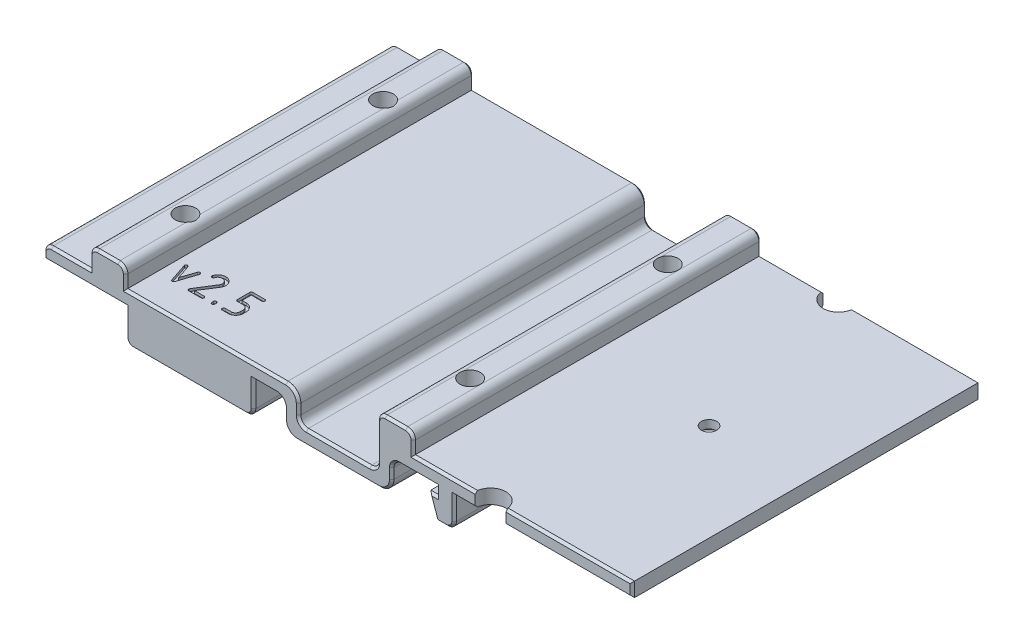
from build123d import *

# Parameters (mm, degrees)
MAINBODY_DEPTH            = 34
FILLET_CORNERS_INSIDE_R   = 1.5
FILLET_CORNERS_OUTSIDE_R  = 2.5
SPRING_SLOT_DEPTH         = 1.05
SPRING_ENTRY_REACH        = 70.899
FILLET2_R                 = 8
CUT_VERSION_DEPTH         = 0.5
SKETCH7_R                 = 1.5
PANEL_HOLE_DEPTH          = 10
SKETCH10_R                = 3
COUNTERBORE_DEPTH         = 1.2
SKETCH11_W                = 7
SKETCH11_H                = 4
BOSS_EXTRUDE2_DEPTH       = 34
HOLES_BATMOUNT_DEPTH      = 69.606705261
HOLES_BATMOUNT_DEPTH_BACK = 69.606705261
SKETCH9_R                 = 2
FILLET3_R                 = 1.5
CHAMF_FACE_SIZE           = 0.45
SKETCH12_R                = 3
CUT_EXTRUDE1_DEPTH        = 69.606705222


with BuildPart() as part:
    # Sketch1 → mainBody (new, symmetric)
    with BuildSketch(Plane.XY):
        Polygon((-18.2, 0), (-18.2, -6.5), (-43.2, -6.5), (-43.2, 0), (-59.2, 0), (-59.2, 2.8), (-9.4, 2.8), (-9.4, -3.2), (6, -3.2), (6, 2.8), (21.072520582, 2.8), (55.8, 2.8), (55.8, 0), (21, 0), (21, -6), (17.5, -6), (16, -1.7), (17.5, -1.7), (17.5, 0), (8.8, 0), (8.8, -6), (-12.2, -6), (-12.2, 0), align=None)
    extrude(amount=MAINBODY_DEPTH, both=True)

    # fillet_corners_inside
    fillet_corners_inside_edges = [part.edges().sort_by_distance(p)[0] for p in [
        (-18.2, -6.5, 0),
        (-43.2, -6.5, 0),
        (-59.2, 2.8, 0),
        (-9.4, -3.2, 0),
        (6, -3.2, 0),
        (21, -6, 0),
        (8.8, 0, 0),
        (-12.2, 0, 0),
    ]]
    fillet(fillet_corners_inside_edges, radius=FILLET_CORNERS_INSIDE_R)

    # fillet_corners_outside
    fillet_corners_outside_edges = [part.edges().sort_by_distance(p)[0] for p in [
        (-9.4, 2.8, 0),
        (8.8, -6, 0),
        (-12.2, -6, 0),
    ]]
    fillet(fillet_corners_outside_edges, radius=FILLET_CORNERS_OUTSIDE_R)

    # Sketch2 → spring_slot (cut, symmetric)
    with BuildSketch(Plane(origin=(0, -2.3, 0), x_dir=(1, 0, 0), z_dir=(0, 1, 0))):
        Polygon((-44, 6.5), (-27.5, 7.5), (-20.5, 11), (-20.5, 16.5), (-18.2, 16.5), (-18.2, -16.5), (-20.5, -16.5), (-20.5, -11), (-27.5, -7.5), (-44, -6.5), align=None)
    extrude(amount=SPRING_SLOT_DEPTH, both=True, mode=Mode.SUBTRACT)

    # spring_entry: up to this face of the body (flat: up to its plane)
    spring_entry_end = Plane(part.part.faces().sort_by_distance((-28.889556928, -1.25, 0))[0])
    # Sketch4 → spring_entry (cut, up to the picked face)
    with BuildSketch(Plane.XZ.offset(6.5), mode=Mode.PRIVATE) as spring_entry_sk1:
        Polygon((-43.2, 4.544815121), (-26.971093639, 5.528385203), (-17, 10.513932023), (-17, -10.513932023), (-26.971093639, -5.528385203), (-43.2, -4.544815121), align=None)
    spring_entry_tool1 = split(extrude(spring_entry_sk1.sketch, amount=-SPRING_ENTRY_REACH, mode=Mode.PRIVATE), bisect_by=spring_entry_end, keep=Keep.BOTH, mode=Mode.PRIVATE)
    add(spring_entry_tool1.solids().sort_by(Axis((-28.217872, -6.5, 0), (0, 1, 0)))[0], mode=Mode.SUBTRACT)

    # Fillet2
    fillet2_edges = [part.edges().sort_by_distance(p)[0] for p in [
        (-26.971093639, -4.925, -5.528385203),
        (-26.971093639, -4.925, 5.528385203),
    ]]
    fillet(fillet2_edges, radius=FILLET2_R)

    # Sketch5 → cut_version (cut)
    with BuildSketch(Plane(origin=(0, 2.8, 0), x_dir=(1, 0, 0), z_dir=(0, 1, 0))):
        with BuildLine():
            add(Edge.make_bspline(
                [(-41.601512481, -24.084865663), (-41.599266039, -24.104295768), (-41.594915441, -24.141925322), (-41.582725099, -24.177780618), (-41.576829268, -24.195121951)],
                knots=[0, 0, 0, 0, 1.032704525, 2, 2, 2, 2], degree=3))
            Line((-41.576829268, -24.195121951), (-40.379249238, -27.77648509))
            add(Edge.make_bspline(
                [(-40.379249238, -27.77648509), (-40.366158729, -27.80789855), (-40.341241866, -27.867691862), (-40.273281502, -27.936414851), (-40.189557542, -27.983520924), (-40.125842153, -27.991953119), (-40.092682927, -27.996341463)],
                knots=[0, 0, 0, 0, 1.054683453, 2.007515722, 2.96305683, 4, 4, 4, 4], degree=3))
            add(Edge.make_bspline(
                [(-40.092682927, -27.996341463), (-40.057919516, -27.992026061), (-39.991876221, -27.983827687), (-39.905120587, -27.937212007), (-39.836949217, -27.867675055), (-39.811914442, -27.808089528), (-39.798780488, -27.776829268)],
                knots=[0, 0, 0, 0, 1.06836729, 2.029677035, 2.966312611, 4, 4, 4, 4], degree=3))
            Line((-39.798780488, -27.776829268), (-38.600645484, -24.194184689))
            add(Edge.make_bspline(
                [(-38.600645484, -24.194184689), (-38.596201969, -24.177105546), (-38.586917044, -24.141417907), (-38.585095923, -24.104576142), (-38.584146341, -24.085365854)],
                knots=[0, 0, 0, 0, 0.957146177, 2, 2, 2, 2], degree=3))
            add(Edge.make_bspline(
                [(-38.584146341, -24.085365854), (-38.585769724, -24.065295583), (-38.588911508, -24.026452945), (-38.607211905, -23.971225807), (-38.63362859, -23.920299891), (-38.672145008, -23.876818457), (-38.717421034, -23.84010539), (-38.768529001, -23.811121378), (-38.826812568, -23.79556053), (-38.866994554, -23.792057914), (-38.887804878, -23.790243902)],
                knots=[0, 0, 0, 0, 1.027789528, 1.989114056, 2.957849911, 3.946954469, 4.938684973, 5.935646619, 6.930867606, 8, 8, 8, 8], degree=3))
            add(Edge.make_bspline(
                [(-38.887804878, -23.790243902), (-38.92088275, -23.794763663), (-38.984249761, -23.803422132), (-39.069193742, -23.848700331), (-39.135838962, -23.918897605), (-39.16116445, -23.978585262), (-39.174390244, -24.009756098)],
                knots=[0, 0, 0, 0, 1.03692919, 1.986436811, 2.948451835, 4, 4, 4, 4], degree=3))
            Line((-39.174390244, -24.009756098), (-40.092649581, -26.742158918))
            Line((-40.092649581, -26.742158918), (-41.003024962, -24.00918326))
            add(Edge.make_bspline(
                [(-41.003024962, -24.00918326), (-41.016476638, -23.978195042), (-41.042374756, -23.918534329), (-41.110385958, -23.848247255), (-41.198345611, -23.803073446), (-41.264080541, -23.794676471), (-41.298780488, -23.790243902)],
                knots=[0, 0, 0, 0, 1.028913269, 1.980936724, 2.934183284, 4, 4, 4, 4], degree=3))
            add(Edge.make_bspline(
                [(-41.298780488, -23.790243902), (-41.318779752, -23.792076376), (-41.357755011, -23.795647563), (-41.414754829, -23.811347063), (-41.465650967, -23.840424361), (-41.511991888, -23.876727956), (-41.551567827, -23.920256963), (-41.579587287, -23.970899614), (-41.597599876, -24.02649028), (-41.600790438, -24.065308303), (-41.602439024, -24.085365854)],
                knots=[0, 0, 0, 0, 1.030543514, 2.008358934, 3.007991962, 4.018680577, 5.024181706, 6.005556065, 6.969456486, 8, 8, 8, 8], degree=3))
            Line((-41.602439024, -24.085365854), (-41.601512481, -24.084865663))
        make_face()
        with BuildLine():
            add(Edge.make_bspline(
                [(-34.362600038, -24.274204459), (-34.32745803, -24.213040732), (-34.257008702, -24.090425559), (-34.189208324, -23.889720748), (-34.144568218, -23.686513454), (-34.138389372, -23.549817015), (-34.135365854, -23.482926829)],
                knots=[0, 0, 0, 0, 1.013787966, 2.032344872, 3.037159877, 4, 4, 4, 4], degree=3))
            add(Edge.make_bspline(
                [(-34.135365854, -23.482926829), (-34.138125458, -23.430814596), (-34.143540461, -23.328557953), (-34.166917971, -23.178610107), (-34.203821489, -23.035463838), (-34.252510745, -22.897993996), (-34.31471738, -22.767004681), (-34.391280016, -22.643426603), (-34.479069053, -22.525954071), (-34.578914585, -22.416717745), (-34.688154113, -22.316885671), (-34.805600824, -22.229040614), (-34.928965133, -22.152878569), (-35.059227034, -22.090006889), (-35.196463702, -22.041677291), (-35.339579053, -22.004708858), (-35.489535321, -21.981349031), (-35.5917908, -21.975931582), (-35.643902439, -21.973170732)],
                knots=[0, 0, 0, 0, 1.058443009, 2.076917897, 3.073239101, 4.054247521, 5.031990651, 6.00955979, 6.999406302, 8.003719833, 9.008033365, 9.997879877, 10.975449016, 11.945752479, 12.926760899, 13.923082103, 14.941556991, 16, 16, 16, 16], degree=3))
            add(Edge.make_bspline(
                [(-35.643902439, -21.973170732), (-35.685820719, -21.974980276), (-35.768306494, -21.978541055), (-35.890278482, -21.994729369), (-36.008282165, -22.019963815), (-36.121985552, -22.05557393), (-36.231384342, -22.100219364), (-36.337714402, -22.151923211), (-36.439056069, -22.215034316), (-36.569094393, -22.309054976), (-36.718090163, -22.445681225), (-36.877592302, -22.629807676), (-37.017662934, -22.83478846), (-37.090849739, -22.984752566), (-37.12804878, -23.06097561)],
                knots=[0, 0, 0, 0, 0.775863489, 1.526725378, 2.27305486, 3.005618887, 3.727569145, 4.457348924, 5.189912951, 5.932977202, 7.423702791, 8.916361755, 10.432662988, 12, 12, 12, 12], degree=3))
            add(Edge.make_bspline(
                [(-37.12804878, -23.06097561), (-37.135666866, -23.079430084), (-37.151300549, -23.117301986), (-37.152859329, -23.158265668), (-37.153658537, -23.179268293)],
                knots=[0, 0, 0, 0, 0.974573408, 2, 2, 2, 2], degree=3))
            add(Edge.make_bspline(
                [(-37.153658537, -23.179268293), (-37.152018926, -23.20014003), (-37.148844065, -23.240555047), (-37.130875585, -23.297914792), (-37.104226682, -23.350415293), (-37.065616519, -23.394884812), (-37.021147, -23.433494975), (-36.968646499, -23.460143878), (-36.911286754, -23.478112357), (-36.870871737, -23.481287219), (-36.85, -23.482926829)],
                knots=[0, 0, 0, 0, 1.052730986, 2.038457085, 3.010444171, 4, 4.989555829, 5.961542915, 6.947269014, 8, 8, 8, 8], degree=3))
            add(Edge.make_bspline(
                [(-36.85, -23.482926829), (-36.815295642, -23.478496474), (-36.749552354, -23.47010369), (-36.661650295, -23.424900995), (-36.593366422, -23.35466862), (-36.568044563, -23.294631773), (-36.554878049, -23.263414634)],
                knots=[0, 0, 0, 0, 1.065202536, 2.017899786, 2.969374635, 4, 4, 4, 4], degree=3))
            add(Edge.make_bspline(
                [(-36.554878049, -23.263414634), (-36.541614886, -23.213595688), (-36.515647515, -23.116057342), (-36.446943972, -22.982417094), (-36.356666224, -22.865891169), (-36.245735942, -22.768521591), (-36.120343987, -22.689069407), (-35.982346178, -22.631157468), (-35.833775324, -22.596513374), (-35.731481654, -22.590747785), (-35.679268293, -22.587804878)],
                knots=[0, 0, 0, 0, 1.030680226, 2.017923977, 2.987398872, 3.96827074, 4.96037523, 5.949767355, 6.953507688, 8, 8, 8, 8], degree=3))
            add(Edge.make_bspline(
                [(-35.679268293, -22.587804878), (-35.617877193, -22.594104007), (-35.497653067, -22.606439789), (-35.326979132, -22.662735093), (-35.17262359, -22.748424787), (-35.038050234, -22.862083858), (-34.92518361, -22.996823449), (-34.841753753, -23.15087421), (-34.790722121, -23.321314239), (-34.78153302, -23.440308357), (-34.776829268, -23.501219512)],
                knots=[0, 0, 0, 0, 1.043300576, 2.043128441, 3.020592189, 4.018068269, 5.011134672, 5.981974443, 6.967005516, 8, 8, 8, 8], degree=3))
            add(Edge.make_bspline(
                [(-34.776829268, -23.501219512), (-34.77798699, -23.543229791), (-34.780289034, -23.626764091), (-34.80634037, -23.748637285), (-34.844515031, -23.867125129), (-34.883775576, -23.939948751), (-34.903658537, -23.976829268)],
                knots=[0, 0, 0, 0, 1.010874498, 2.01004839, 2.992216505, 4, 4, 4, 4], degree=3))
            Line((-34.903658537, -23.976829268), (-37.136862853, -27.531459604))
            add(Edge.make_bspline(
                [(-37.136862853, -27.531459604), (-37.15019468, -27.554157264), (-37.177940978, -27.601395804), (-37.18443248, -27.655854514), (-37.187804878, -27.684146341)],
                knots=[0, 0, 0, 0, 0.960980606, 2, 2, 2, 2], degree=3))
            add(Edge.make_bspline(
                [(-37.187804878, -27.684146341), (-37.186629594, -27.705015303), (-37.184329567, -27.74585578), (-37.166436384, -27.803682343), (-37.139587487, -27.856507249), (-37.10098506, -27.90098506), (-37.056507249, -27.939587487), (-37.003682343, -27.966436384), (-36.94585578, -27.984329567), (-36.905015303, -27.986629594), (-36.884146341, -27.987804878)],
                knots=[0, 0, 0, 0, 1.045974665, 2.046968367, 3.014737927, 4, 4.985262073, 5.953031633, 6.954025335, 8, 8, 8, 8], degree=3))
            Line((-36.884146341, -27.987804878), (-34.473171923, -27.987804878))
            add(Edge.make_bspline(
                [(-34.473171923, -27.987804878), (-34.452713985, -27.986594806), (-34.412290541, -27.984203789), (-34.354854506, -27.966437747), (-34.302029265, -27.93958712), (-34.257551544, -27.90098516), (-34.218949093, -27.856507223), (-34.192100202, -27.80368235), (-34.174207018, -27.745855778), (-34.171906991, -27.705015302), (-34.170731707, -27.684146341)],
                knots=[0, 0, 0, 0, 1.028290674, 2.031829889, 3.002060474, 3.989828055, 4.977595636, 5.947826221, 6.951365436, 8, 8, 8, 8], degree=3))
            add(Edge.make_bspline(
                [(-34.170731707, -27.684146341), (-34.171817936, -27.66325411), (-34.173903125, -27.623148145), (-34.192384366, -27.566686259), (-34.21897179, -27.515370478), (-34.257618212, -27.472159709), (-34.302088574, -27.434644105), (-34.355171455, -27.409417327), (-34.412643621, -27.391200055), (-34.453508707, -27.388953062), (-34.474390244, -27.387804878)],
                knots=[0, 0, 0, 0, 1.058535215, 2.032026861, 2.993167411, 3.974516965, 4.958471876, 5.928450685, 6.941464785, 8, 8, 8, 8], degree=3))
            Line((-34.474390244, -27.387804878), (-36.344499095, -27.387804878))
            Line((-36.344499095, -27.387804878), (-34.362600038, -24.274204459))
        make_face()
        with BuildLine():
            add(Edge.make_bspline(
                [(-32.669312119, -27.68091654), (-32.668237959, -27.702048593), (-32.666148313, -27.743158401), (-32.648197003, -27.801300767), (-32.620910762, -27.854135228), (-32.583188947, -27.899827462), (-32.537819803, -27.938088333), (-32.485774351, -27.966735829), (-32.427509997, -27.984234789), (-32.386704663, -27.986597542), (-32.365853659, -27.987804878)],
                knots=[0, 0, 0, 0, 1.053795159, 2.050028647, 3.013195991, 4.009429478, 4.990006149, 5.962765968, 6.958999455, 8, 8, 8, 8], degree=3))
            add(Edge.make_bspline(
                [(-32.365853659, -27.987804878), (-32.344988368, -27.986648054), (-32.304544958, -27.984405771), (-32.246835528, -27.966454085), (-32.195100178, -27.938113353), (-32.149738847, -27.89982068), (-32.112019241, -27.85413672), (-32.084716556, -27.801301329), (-32.066907708, -27.743401277), (-32.064595926, -27.702571044), (-32.063414634, -27.681707317)],
                knots=[0, 0, 0, 0, 1.045213593, 2.025948432, 3.002645121, 3.987190297, 4.987455656, 5.954521048, 6.954786407, 8, 8, 8, 8], degree=3))
            Line((-32.063414634, -27.681707317), (-32.062395198, -27.382552877))
            add(Edge.make_bspline(
                [(-32.062395198, -27.382552877), (-32.063974116, -27.361002338), (-32.067042142, -27.319127062), (-32.084749609, -27.259788488), (-32.111335904, -27.205963677), (-32.149867697, -27.161154462), (-32.195134017, -27.123925955), (-32.247162353, -27.097185562), (-32.304506578, -27.07893233), (-32.344975306, -27.076740533), (-32.365853659, -27.075609756)],
                knots=[0, 0, 0, 0, 1.076562654, 2.091889952, 3.072719245, 4.052917712, 5.020200157, 5.982996012, 6.959400964, 8, 8, 8, 8], degree=3))
            add(Edge.make_bspline(
                [(-32.365853659, -27.075609756), (-32.386717746, -27.076791066), (-32.427548685, -27.079102884), (-32.485443674, -27.096911477), (-32.53778668, -27.123951104), (-32.583056625, -27.161148034), (-32.621607443, -27.205963802), (-32.648112754, -27.259794523), (-32.666167836, -27.319187294), (-32.668374358, -27.361241006), (-32.669512195, -27.382926829)],
                knots=[0, 0, 0, 0, 1.037498569, 2.03038068, 2.990307883, 3.954708309, 4.931986273, 5.909893183, 6.922195311, 8, 8, 8, 8], degree=3))
            Line((-32.669512195, -27.382926829), (-32.669312119, -27.68091654))
        make_face()
        with BuildLine():
            add(Edge.make_bspline(
                [(-30.336585366, -21.998982946), (-30.357444909, -22.00058701), (-30.398232701, -22.003723523), (-30.456128351, -22.021303023), (-30.508944392, -22.048235032), (-30.553424593, -22.086815053), (-30.592026378, -22.131298878), (-30.618875445, -22.184122192), (-30.636768582, -22.24194919), (-30.639068615, -22.282789606), (-30.640243902, -22.303658537)],
                knots=[0, 0, 0, 0, 1.047537158, 2.048305948, 3.015858061, 4.000898756, 4.985939451, 5.953491565, 6.954260354, 8, 8, 8, 8], degree=3))
            Line((-30.640243902, -22.303658537), (-30.640043826, -24.72195241))
            add(Edge.make_bspline(
                [(-30.640043826, -24.72195241), (-30.639040303, -24.743248776), (-30.637112813, -24.784153182), (-30.618589693, -24.84180811), (-30.592055879, -24.894319903), (-30.553416152, -24.938787838), (-30.508948354, -24.977392916), (-30.456120796, -25.004241111), (-30.398294957, -25.022134485), (-30.357454379, -25.024434485), (-30.336585366, -25.025609756)],
                knots=[0, 0, 0, 0, 1.065897333, 2.047292805, 3.015009622, 4.000217999, 4.985426375, 5.953143192, 6.95408234, 8, 8, 8, 8], degree=3))
            Line((-30.336585366, -25.025609756), (-29.165841749, -25.025410871))
            add(Edge.make_bspline(
                [(-29.165841749, -25.025410871), (-29.106144056, -25.029730098), (-28.989999073, -25.03813338), (-28.824294084, -25.088320588), (-28.675275415, -25.168777967), (-28.546250258, -25.27847208), (-28.437832859, -25.40929235), (-28.360586694, -25.561979381), (-28.309624863, -25.730164132), (-28.302460755, -25.848807778), (-28.298780488, -25.909756098)],
                knots=[0, 0, 0, 0, 1.040996678, 2.02531348, 2.992539971, 3.973483014, 4.96083143, 5.933960118, 6.938656533, 8, 8, 8, 8], degree=3))
            Line((-28.298780488, -25.909756098), (-28.298581603, -26.495693598))
            add(Edge.make_bspline(
                [(-28.298581603, -26.495693598), (-28.302317183, -26.556862793), (-28.309576142, -26.675726453), (-28.360793389, -26.844423221), (-28.438066091, -26.998175646), (-28.546215702, -27.131004671), (-28.674460083, -27.243678068), (-28.824606679, -27.323413582), (-28.98972761, -27.37574744), (-29.10610106, -27.383714266), (-29.165853659, -27.387804878)],
                knots=[0, 0, 0, 0, 1.060912391, 2.061559373, 3.037043088, 4.031396316, 5.017522772, 5.980850851, 6.963256587, 8, 8, 8, 8], degree=3))
            Line((-29.165853659, -27.387804878), (-30.336585366, -27.387804878))
            add(Edge.make_bspline(
                [(-30.336585366, -27.387804878), (-30.357466903, -27.388953062), (-30.398331989, -27.391200055), (-30.455804155, -27.409417327), (-30.508887036, -27.434644105), (-30.553357398, -27.472159709), (-30.59200382, -27.515370478), (-30.618591244, -27.566686259), (-30.637072485, -27.623148145), (-30.639157674, -27.66325411), (-30.640243902, -27.684146341)],
                knots=[0, 0, 0, 0, 1.058535215, 2.071549315, 3.041528124, 4.025483035, 5.006832589, 5.967973139, 6.941464785, 8, 8, 8, 8], degree=3))
            add(Edge.make_bspline(
                [(-30.640243902, -27.684146341), (-30.639068618, -27.705015303), (-30.636768591, -27.74585578), (-30.618875409, -27.803682343), (-30.592026512, -27.856507249), (-30.553424085, -27.90098506), (-30.508946274, -27.939587487), (-30.456121367, -27.966436384), (-30.398294804, -27.984329567), (-30.357454327, -27.986629594), (-30.336585366, -27.987804878)],
                knots=[0, 0, 0, 0, 1.045974665, 2.046968367, 3.014737927, 4, 4.985262073, 5.953031633, 6.954025335, 8, 8, 8, 8], degree=3))
            Line((-30.336585366, -27.987804878), (-29.165841749, -27.987804878))
            add(Edge.make_bspline(
                [(-29.165841749, -27.987804878), (-29.115351188, -27.985545053), (-29.015890208, -27.98109344), (-28.870044226, -27.957383927), (-28.730521955, -27.920623287), (-28.596917564, -27.871763541), (-28.46958559, -27.81036874), (-28.34803697, -27.737349196), (-28.233925007, -27.649362884), (-28.126848682, -27.550391923), (-28.027776233, -27.442705724), (-27.942396622, -27.326046353), (-27.868863164, -27.20361578), (-27.807027152, -27.074917464), (-27.759896618, -26.938869998), (-27.724534372, -26.796843573), (-27.700846654, -26.648696225), (-27.695432014, -26.547646028), (-27.692682927, -26.496341463)],
                knots=[0, 0, 0, 0, 1.043438142, 2.055461039, 3.045431019, 4.020506367, 4.989596152, 5.961774011, 6.944378732, 7.960678462, 8.971306619, 9.96230906, 10.941678564, 11.918343867, 12.906388458, 13.910540743, 14.939153019, 16, 16, 16, 16], degree=3))
            Line((-27.692682927, -26.496341463), (-27.691664682, -25.909213034))
            add(Edge.make_bspline(
                [(-27.691664682, -25.909213034), (-27.694852389, -25.858097), (-27.701140311, -25.75726791), (-27.724464885, -25.609248727), (-27.759914993, -25.467229217), (-27.807021346, -25.331178626), (-27.868868328, -25.202485996), (-27.94238162, -25.080035675), (-28.027832213, -24.963450971), (-28.126449386, -24.855682565), (-28.234299299, -24.757931004), (-28.348343878, -24.670083173), (-28.469253781, -24.595626668), (-28.596697237, -24.534079508), (-28.730787043, -24.487033827), (-28.870008188, -24.449829896), (-29.015903548, -24.42624992), (-29.115362286, -24.421780929), (-29.165853659, -24.419512195)],
                knots=[0, 0, 0, 0, 1.058122533, 2.087202883, 3.091812112, 4.080306317, 5.057416056, 6.037231227, 7.028684628, 8.039772676, 9.050860724, 10.033912584, 11.01091395, 11.980444723, 12.953101265, 13.943521735, 14.956005158, 16, 16, 16, 16], degree=3))
            Line((-29.165853659, -24.419512195), (-30.033126905, -24.41849395))
            Line((-30.033126905, -24.41849395), (-30.033126905, -22.605899867))
            Line((-30.033126905, -22.605899867), (-27.995123142, -22.605899867))
            add(Edge.make_bspline(
                [(-27.995123142, -22.605899867), (-27.97466348, -22.604773026), (-27.934230321, -22.602546122), (-27.876807528, -22.584717127), (-27.823978306, -22.557883883), (-27.77950983, -22.519274842), (-27.740874478, -22.474807722), (-27.71432405, -22.422296634), (-27.695987811, -22.365020027), (-27.693807683, -22.324541793), (-27.692682927, -22.303658537)],
                knots=[0, 0, 0, 0, 1.03053182, 2.036575987, 3.009228382, 3.999461547, 4.989694712, 5.962347107, 6.94874792, 8, 8, 8, 8], degree=3))
            add(Edge.make_bspline(
                [(-27.692682927, -22.303658537), (-27.693858211, -22.282789575), (-27.696158238, -22.241949098), (-27.714051421, -22.184122535), (-27.740900318, -22.131297629), (-27.779502744, -22.086819818), (-27.823980556, -22.048217391), (-27.876805462, -22.021368494), (-27.934632025, -22.003475311), (-27.975472502, -22.001175284), (-27.996341463, -22)],
                knots=[0, 0, 0, 0, 1.045974665, 2.046968367, 3.014737927, 4, 4.985262073, 5.953031633, 6.954025335, 8, 8, 8, 8], degree=3))
            Line((-27.996341463, -22), (-30.336585366, -21.998982946))
        make_face()
    extrude(amount=-CUT_VERSION_DEPTH, mode=Mode.SUBTRACT)

    # Sketch7 → panel_hole (cut)
    with BuildSketch(Plane(origin=(0, 0, 0), x_dir=(1, 0, 0), z_dir=(0, 1, 0))):
        with Locations((36.8, 0)):
            Circle(SKETCH7_R)
    extrude(amount=PANEL_HOLE_DEPTH, mode=Mode.SUBTRACT)

    # Sketch10 → counterBore (cut)
    with BuildSketch(Plane.XZ):
        with Locations(Location((36.8, 0, 0), (0, 0, 270))):
            Circle(SKETCH10_R)
    extrude(amount=-COUNTERBORE_DEPTH, mode=Mode.SUBTRACT)

    # Sketch11 → Boss-Extrude2 (add, symmetric)
    with BuildSketch(Plane.XY):
        with Locations((-46.7, 4.8)):
            Rectangle(SKETCH11_W, SKETCH11_H)
        with Locations((9.5, 4.8)):
            Rectangle(SKETCH11_W, SKETCH11_H)
    extrude(amount=BOSS_EXTRUDE2_DEPTH, both=True)

    # Sketch9 → holes_batMount (cut, two sides: drawn at the far end of the back side and taken through both)
    with BuildSketch(Plane(origin=(0, 0, 0), x_dir=(1, 0, 0), z_dir=(0, 1, 0)).offset(-HOLES_BATMOUNT_DEPTH_BACK)):
        with Locations(Location((-46.2, 19.305, 0), (0, 0, 41.409622109))):
            Circle(SKETCH9_R)
        with Locations(Location((9.43, 19.305, 0), (0, 0, 108.360813794))):
            Circle(SKETCH9_R)
        with Locations(Location((9.43, -19.305, 0), (0, 0, 108.360813794))):
            Circle(SKETCH9_R)
        with Locations(Location((-46.2, -19.305, 0), (0, 0, 41.409622109))):
            Circle(SKETCH9_R)
    extrude(amount=HOLES_BATMOUNT_DEPTH + HOLES_BATMOUNT_DEPTH_BACK, mode=Mode.SUBTRACT)

    # Fillet3
    # the kernel refuses this fillet: 1.5 mm, written as the material it takes off along each edge
    with BuildSketch(Plane(origin=(-50.2, 6.8, 37.75), x_dir=(1, 0, 0), z_dir=(0, 0, -1)), Plane(origin=(6, 6.8, 37.75), x_dir=(1, 0, 0), z_dir=(0, 0, -1))) as fillet3_piece_1:
        with BuildLine():
            CenterArc((FILLET3_R, FILLET3_R), FILLET3_R, 180, 90)
            Line((0, FILLET3_R), (0, 0))
            Line((0, 0), (FILLET3_R, 0))
        make_face()
    extrude(amount=75.5, mode=Mode.SUBTRACT)
    with BuildSketch(Plane(origin=(-43.2, 6.8, -37.75), x_dir=(0, -1, 0), z_dir=(0, 0, 1)), Plane(origin=(13, 6.8, -37.75), x_dir=(0, -1, 0), z_dir=(0, 0, 1))) as fillet3_piece_2:
        with BuildLine():
            CenterArc((FILLET3_R, -FILLET3_R), FILLET3_R, 90, 90)
            Line((0, -FILLET3_R), (0, 0))
            Line((0, 0), (FILLET3_R, 0))
        make_face()
    extrude(amount=75.5, mode=Mode.SUBTRACT)

    # chamf_face
    chamf_face_edges = [part.edges().sort_by_distance(p)[0] for p in [
        (8.8, -2.5, -34),
        (8.8, -2.5, 34),
        (-27.55, 2.8, -34),
        (-1.7, -6, -34),
        (-10.132233047, 2.067766953, -34),
        (-11.467766953, -5.267766953, -34),
        (8.067766953, -5.267766953, -34),
        (-1.7, -6, 34),
        (-27.55, 2.8, 34),
        (-10.132233047, 2.067766953, 34),
        (-11.467766953, -5.267766953, 34),
        (8.067766953, -5.267766953, 34),
        (-43.2, -2.5, -34),
        (-51.2, 0, -34),
        (17.5, -0.85, 34),
        (34.4, 2.8, -34),
        (55.8, 1.4, -34),
        (38.4, 0, -34),
        (18.5, -6, -34),
        (16.75, -3.85, -34),
        (16.75, -1.7, -34),
        (17.5, -0.85, -34),
        (16.75, -1.7, 34),
        (-15.95, 0, -34),
        (16.75, -3.85, 34),
        (18.5, -6, 34),
        (-53.95, 2.8, -34),
        (-53.95, 2.8, 34),
        (-43.2, 4.05, -34),
        (-43.2, 4.05, 34),
        (13, 4.05, -34),
        (13, 4.05, 34),
        (9.5, 6.8, -34),
        (38.4, 0, 34),
        (9.5, 6.8, 34),
        (-50.2, 4.05, -34),
        (-46.7, 6.8, -34),
        (6, 1.8, -34),
        (-49.760660172, 6.360660172, -34),
        (-43.639339828, 6.360660172, -34),
        (6.439339828, 6.360660172, -34),
        (12.560660172, 6.360660172, -34),
        (6, 1.8, 34),
        (-46.7, 6.8, 34),
        (-50.2, 4.05, 34),
        (-49.760660172, 6.360660172, 34),
        (-43.639339828, 6.360660172, 34),
        (6.439339828, 6.360660172, 34),
        (12.560660172, 6.360660172, 34),
        (55.8, 1.4, 34),
        (-15.95, 0, 34),
        (34.4, 2.8, 34),
        (13.9, 0, -34),
        (13.9, 0, 34),
        (-12.2, -2.5, -34),
        (-12.2, -2.5, 34),
        (-18.2, -2.5, -34),
        (-18.2, -2.5, 34),
        (-30.7, -6.5, -34),
        (-59.2, 0.65, -34),
        (-9.4, -0.7, -34),
        (-1.7, -3.2, -34),
        (21, -2.25, -34),
        (-58.760660172, 2.360660172, -34),
        (-42.760660172, -6.060660172, -34),
        (20.560660172, -5.560660172, -34),
        (-18.639339828, -6.060660172, -34),
        (-30.7, -6.5, 34),
        (21, -2.25, 34),
        (-1.7, -3.2, 34),
        (-9.4, -0.7, 34),
        (-59.2, 0.65, 34),
        (-58.760660172, 2.360660172, 34),
        (-42.760660172, -6.060660172, 34),
        (20.560660172, -5.560660172, 34),
        (-18.639339828, -6.060660172, 34),
        (-51.2, 0, 34),
        (-43.2, -2.5, 34),
        (9.239339828, -0.439339828, -34),
        (9.239339828, -0.439339828, 34),
        (-12.639339828, -0.439339828, -34),
        (-12.639339828, -0.439339828, 34),
        (5.560660172, -2.760660172, -34),
        (5.560660172, -2.760660172, 34),
        (-8.960660172, -2.760660172, -34),
        (-8.960660172, -2.760660172, 34),
    ]]
    chamfer(chamf_face_edges, length=CHAMF_FACE_SIZE)

    # Sketch12 → Cut-Extrude1 (cut, symmetric)
    with BuildSketch(Plane(origin=(0, 0, 0), x_dir=(1, 0, 0), z_dir=(0, 1, 0))):
        with Locations((28.096910189, -34)):
            Circle(SKETCH12_R)
    cut_extrude1 = extrude(amount=CUT_EXTRUDE1_DEPTH, both=True, mode=Mode.SUBTRACT)

    # Mirror1: Cut-Extrude1 across plane
    add(cut_extrude1.mirror(Plane.XY), mode=Mode.SUBTRACT)


solid = part.part
